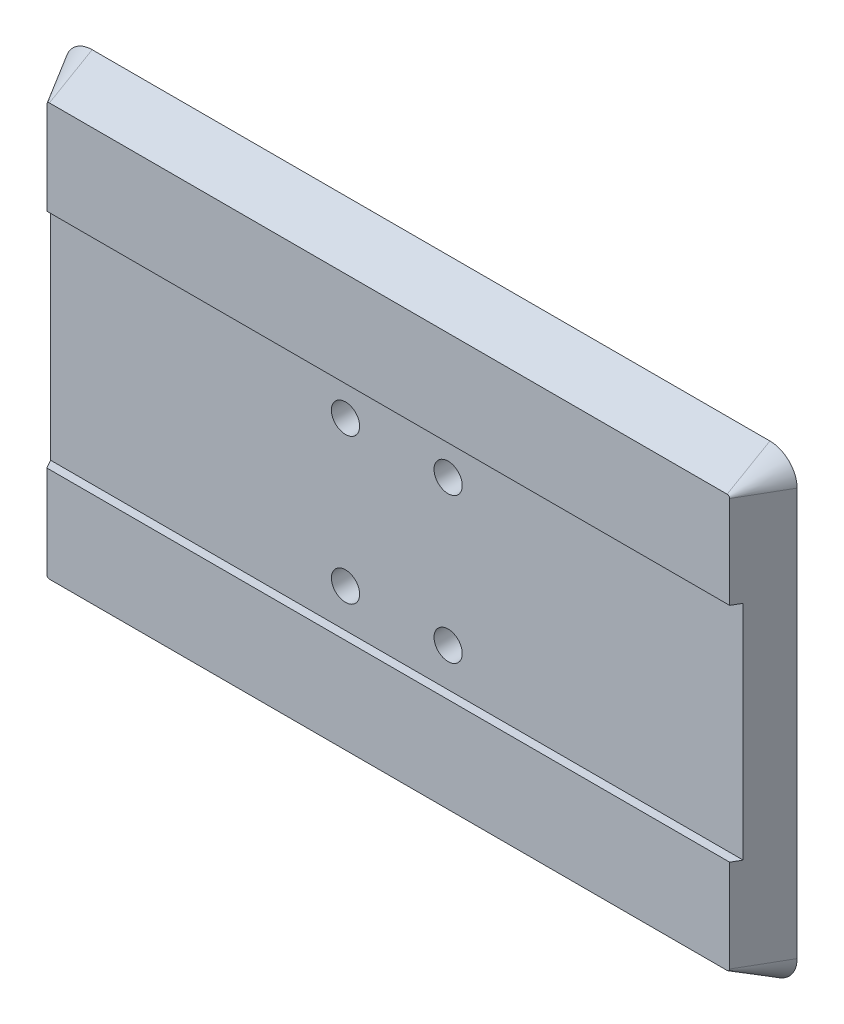
from build123d import *

# Parameters (mm, degrees)
EXTRUDE_1_DEPTH        = 5
CHAMFER_2_SIZE         = 5
CHAMFER_2_SIZE_2       = 2.886751346
SKETCH_5_W             = 92.306776668
SKETCH_5_H             = 26
CUT_EXTRUDE_2_DEPTH    = 1
SKETCH_6_W             = 1
SKETCH_6_H             = 26
CUT_EXTRUDE_3_DEPTH    = 5
HOLE_WIZARD_M4_3_D     = 3.3
HOLE_WIZARD_M4_3_DEPTH = 10.1
HOLE_WIZARD_M4_3_TIP   = 0.991420021


with BuildPart() as part:
    # 草图1 → 凸台-拉伸1 (new body)
    with BuildSketch(Plane.XY):
        with BuildLine():
            Line((3.18, 0), (82.42, 0))
            ThreePointArc((82.42, 0), (84.668599564, 0.931400436), (85.6, 3.18))
            Line((85.6, 3.18), (85.6, 50.82))
            ThreePointArc((85.6, 50.82), (84.668599564, 53.068599564), (82.42, 54))
            Line((82.42, 54), (3.18, 54))
            ThreePointArc((3.18, 54), (0.931400436, 53.068599564), (0, 50.82))
            Line((0, 50.82), (0, 3.18))
            ThreePointArc((0, 3.18), (0.931400436, 0.931400436), (3.18, 0))
        make_face()
    extrude(amount=EXTRUDE_1_DEPTH)

    # 倒角2
    # the kernel refuses this chamfer: 5, 2.886751346 mm, written as the material it takes off along each edge
    with BuildSketch(Plane(origin=(85.6, 3.18, 5), x_dir=(0.019326765612699606, 0, -0.9998132206222079), z_dir=(0, 1, 0)), Plane(origin=(0, 50.82, 5), x_dir=(-0.019326765612700733, 0, -0.9998132206222079), z_dir=(0, -1, 0))) as chamfer_2_piece_1:
        Polygon((CHAMFER_2_SIZE * 0.999813220622, CHAMFER_2_SIZE * 0.0193267656127), (-CHAMFER_2_SIZE_2 * 0.0193267656124, CHAMFER_2_SIZE_2 * 0.999813220604), (0, 0), align=None)
    extrude(amount=47.64, mode=Mode.SUBTRACT)
    with BuildSketch(Plane(origin=(82.42, 50.82, 5), x_dir=(1, 0, 0), z_dir=(0, -1, 0))) as chamfer_2_piece_2:
        Polygon((3.18, -CHAMFER_2_SIZE), (3.18 - CHAMFER_2_SIZE_2, 0), (3.18, 0), align=None)
    revolve(axis=Axis((82.42, 50.82, 5), (0, 0, 1)), revolution_arc=90, mode=Mode.SUBTRACT)
    with BuildSketch(Plane(origin=(82.42, 3.18, 5), x_dir=(0, -1, 0), z_dir=(-1, 0, 0))) as chamfer_2_piece_3:
        Polygon((3.18, -CHAMFER_2_SIZE), (3.18 - CHAMFER_2_SIZE_2, 0), (3.18, 0), align=None)
    revolve(axis=Axis((82.42, 3.18, 5), (0, 0, 1)), revolution_arc=90, mode=Mode.SUBTRACT)
    with BuildSketch(Plane(origin=(82.42, 54, 5), x_dir=(0, 0.01932676561270098, -0.9998132206222079), z_dir=(-1, 0, 0)), Plane(origin=(3.18, 0, 5), x_dir=(0, -0.019326765612700754, -0.9998132206222079), z_dir=(1, 0, 0))) as chamfer_2_piece_4:
        Polygon((CHAMFER_2_SIZE * 0.999813220622, CHAMFER_2_SIZE * 0.0193267656127), (-CHAMFER_2_SIZE_2 * 0.0193267656124, CHAMFER_2_SIZE_2 * 0.999813220604), (0, 0), align=None)
    extrude(amount=79.24, mode=Mode.SUBTRACT)
    with BuildSketch(Plane(origin=(3.18, 50.82, 5), x_dir=(0, 1, 0), z_dir=(1, 0, 0))) as chamfer_2_piece_5:
        Polygon((3.18, -CHAMFER_2_SIZE), (3.18 - CHAMFER_2_SIZE_2, 0), (3.18, 0), align=None)
    revolve(axis=Axis((3.18, 50.82, 5), (0, 0, 1)), revolution_arc=90, mode=Mode.SUBTRACT)
    with BuildSketch(Plane(origin=(3.18, 3.18, 5), x_dir=(-1, 0, 0), z_dir=(0, 1, 0))) as chamfer_2_piece_6:
        Polygon((3.18, -CHAMFER_2_SIZE), (3.18 - CHAMFER_2_SIZE_2, 0), (3.18, 0), align=None)
    revolve(axis=Axis((3.18, 3.18, 5), (0, 0, 1)), revolution_arc=90, mode=Mode.SUBTRACT)

    # 草图5 → 切除-拉伸2 (cut)
    with BuildSketch(Plane.XY.offset(5)):
        with Locations((49.04013968, 27)):
            Rectangle(SKETCH_5_W, SKETCH_5_H)
    extrude(amount=-CUT_EXTRUDE_2_DEPTH, mode=Mode.SUBTRACT)

    # 草图6 → 切除-拉伸3 (cut)
    with BuildSketch(Plane(origin=(2.886751346, 0, 0), x_dir=(0, 0, -1), z_dir=(1, 0, 0))):
        with Locations((-4.5, 27)):
            Rectangle(SKETCH_6_W, SKETCH_6_H)
    extrude(amount=-CUT_EXTRUDE_3_DEPTH, mode=Mode.SUBTRACT)

    # M4 螺纹孔3
    with Locations(Plane.XY.offset(4)):
        with Locations((48.8, 18.5), (48.8, 35.5), (36.8, 18.5), (36.8, 35.5)):
            Hole(HOLE_WIZARD_M4_3_D / 2, depth=HOLE_WIZARD_M4_3_DEPTH)
            with Locations((0, 0, -(HOLE_WIZARD_M4_3_DEPTH + HOLE_WIZARD_M4_3_TIP / 2))):  # 118° drill point
                Cone(0, HOLE_WIZARD_M4_3_D / 2, HOLE_WIZARD_M4_3_TIP, mode=Mode.SUBTRACT)


solid = part.part
